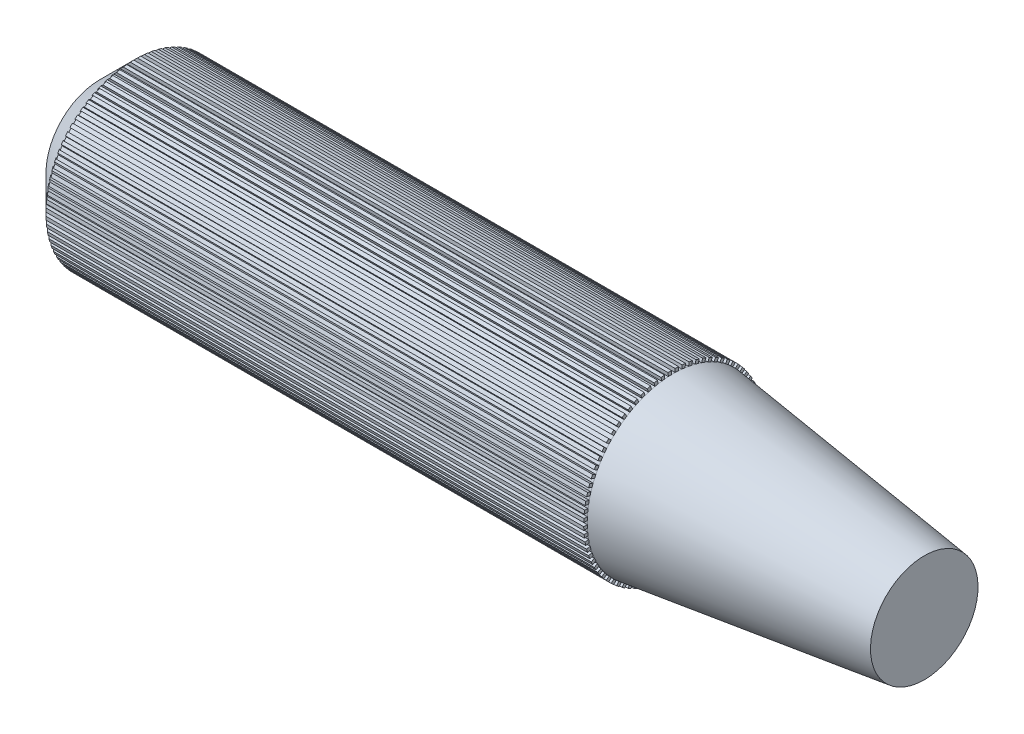
from build123d import *

# Parameters (mm, degrees)
CHAMFER_1_SIZE           = 1
CUT_EXTRUDE_1_DEPTH      = 24.270152556
PATTERN_CIRCULAR_1_COUNT = 80


with BuildPart() as part:
    # 草图1 → 旋转1 (revolve)
    with BuildSketch(Plane.XY):
        Polygon((23, 0), (23, 1.5), (16, 2.4), (16, 2.5), (0, 2.5), (0, 0), align=None)
    revolve(axis=Axis((0, 0, 0), (1, 0, 0)))

    # 倒角1
    chamfer_1_edges = [part.edges().sort_by_distance(p)[0] for p in [
        (0, -2.5, 0),
    ]]
    chamfer(chamfer_1_edges, length=CHAMFER_1_SIZE)

    # 草图2 → 切除-拉伸1 (cut, through all)
    with BuildSketch(Plane.ZY):
        with BuildLine():
            Line((0.05, -4.904793681), (0.05, -2.39947911))
            ThreePointArc((0.05, -2.39947911), (0, -2.4), (-0.05, -2.39947911))
            Line((-0.05, -2.39947911), (-0.05, -4.904793681))
            Line((-0.05, -4.904793681), (0.05, -4.904793681))
        make_face()
    cut_extrude_1 = extrude(amount=-CUT_EXTRUDE_1_DEPTH, mode=Mode.SUBTRACT)

    # 阵列(圆周)1: 切除-拉伸1 ×80 about axis
    pattern_circular_1_axis = Axis((0, 0, 0), (-1, 0, 0))
    for i in range(1, PATTERN_CIRCULAR_1_COUNT):
        add(cut_extrude_1.rotate(pattern_circular_1_axis, i * 360 / PATTERN_CIRCULAR_1_COUNT), mode=Mode.SUBTRACT)


solid = part.part
